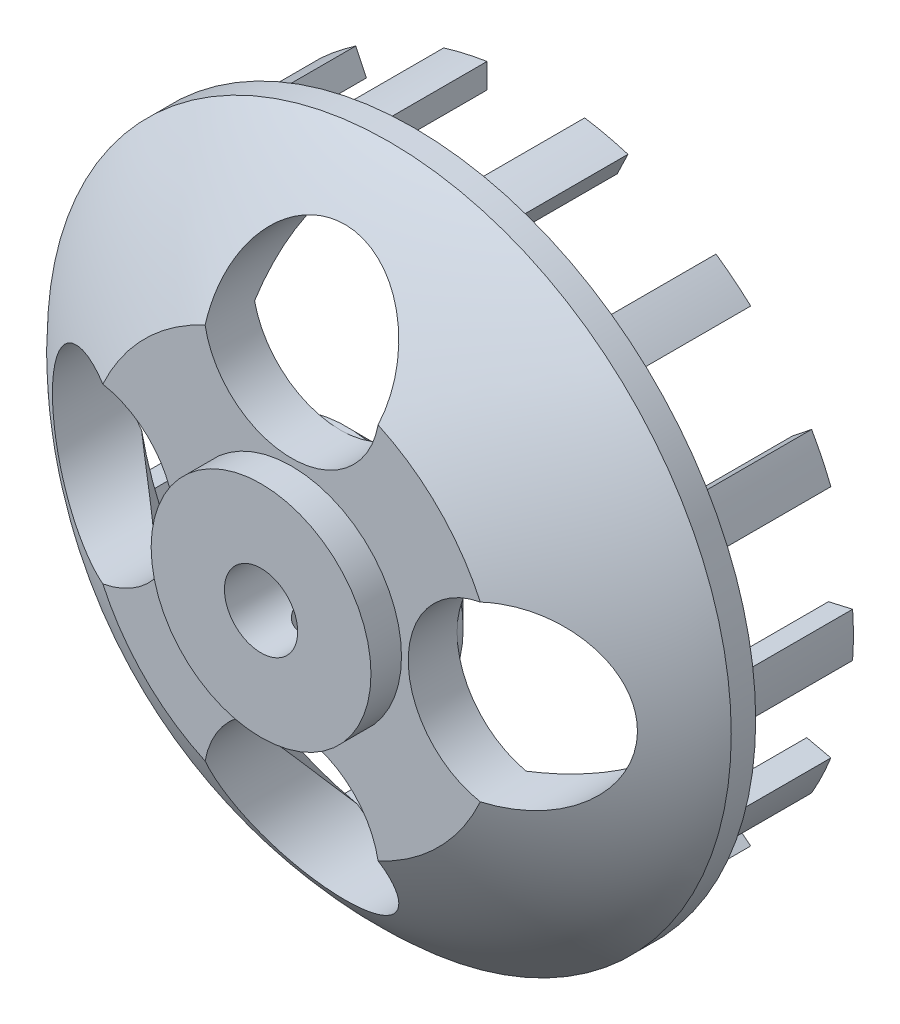
from build123d import *

# Parameters (mm, degrees)
SKETCH1_R           = 14
BOSS_EXTRUDE1_DEPTH = 22
SKETCH2_R           = 12
CUT_EXTRUDE1_DEPTH  = 15
SKETCH3_R           = 17.036826926
SKETCH3_R_2         = 13
CUT_EXTRUDE2_DEPTH  = 15
SKETCH4_R           = 15.163293939
CUT_EXTRUDE3_DEPTH  = 10
SKETCH5_R           = 16.994892588
SKETCH5_R_2         = 4.5
CUT_EXTRUDE4_DEPTH  = 2
SKETCH8_R           = 3.6
CUT_EXTRUDE5_DEPTH  = 7
CIRPATTERN1_COUNT   = 4
SKETCH11_R          = 5.620004384
CUT_EXTRUDE6_DEPTH  = 0.75
SKETCH12_R          = 1.5
CUT_EXTRUDE7_DEPTH  = 18
SKETCH13_R          = 8.375
SKETCH13_R_2        = 4.775
CUT_EXTRUDE8_DEPTH  = 3
FILLET1_SIZE        = 2.75
FILLET2_SIZE        = 3
SKETCH14_W          = 4
SKETCH14_H          = 4.217169846
CUT_EXTRUDE10_DEPTH = 5
CIRPATTERN3_COUNT   = 14
CIRPATTERN3_ANGLE   = 334.282
SKETCH16_R          = 0.75
CUT_EXTRUDE11_DEPTH = 6


with BuildPart() as part:
    # Sketch1 → Boss-Extrude1 (new body)
    with BuildSketch(Plane.XY):
        Circle(SKETCH1_R)
    extrude(amount=BOSS_EXTRUDE1_DEPTH)

    # Sketch2 → Cut-Extrude1 (cut)
    with BuildSketch(Plane(origin=(0, 0, 0), x_dir=(-1, 0, 0), z_dir=(0, 0, -1))):
        Circle(SKETCH2_R)
    extrude(amount=-CUT_EXTRUDE1_DEPTH, mode=Mode.SUBTRACT)

    # Sketch3 → Cut-Extrude2 (cut)
    with BuildSketch(Plane(origin=(0, 0, 0), x_dir=(-1, 0, 0), z_dir=(0, 0, -1))):
        Circle(SKETCH3_R)
        Circle(SKETCH3_R_2, mode=Mode.SUBTRACT)
    extrude(amount=-CUT_EXTRUDE2_DEPTH, mode=Mode.SUBTRACT)

    # Sketch4 → Cut-Extrude3 (cut)
    with BuildSketch(Plane(origin=(0, 0, 0), x_dir=(-1, 0, 0), z_dir=(0, 0, -1))):
        Circle(SKETCH4_R)
    extrude(amount=-CUT_EXTRUDE3_DEPTH, mode=Mode.SUBTRACT)

    # Sketch5 → Cut-Extrude4 (cut)
    with BuildSketch(Plane.XY.offset(22)):
        Circle(SKETCH5_R)
        Circle(SKETCH5_R_2, mode=Mode.SUBTRACT)
    extrude(amount=-CUT_EXTRUDE4_DEPTH, mode=Mode.SUBTRACT)

    # Sketch8 → Cut-Extrude5 (cut)
    with BuildSketch(Plane.XY.offset(20)):
        with Locations((0, 8.375)):
            Circle(SKETCH8_R)
    cut_extrude5 = extrude(amount=-CUT_EXTRUDE5_DEPTH, mode=Mode.SUBTRACT)

    # CirPattern1: Cut-Extrude5 ×4 about axis
    cirpattern1_axis = Axis((0, 0, 0), (0, 0, 1))
    for i in range(1, CIRPATTERN1_COUNT):
        add(cut_extrude5.rotate(cirpattern1_axis, i * 360 / CIRPATTERN1_COUNT), mode=Mode.SUBTRACT)

    # Sketch7 → Cut-Revolve2 (revolve, cut)
    with BuildSketch(Plane(origin=(0, 0, 0), x_dir=(1, 0, 0), z_dir=(0, 1, 0))):
        with BuildLine():
            Line((-14, -16), (-16.211067118, -22.850526422))
            Line((-16.211067118, -22.850526422), (-8.5, -20))
            add(Edge.make_bspline(
                [(-8.5, -20), (-12.342847144, -17.893785877), (-14, -16)],
                knots=[0, 0, 0, 1, 1, 1], degree=2))
        make_face()
    revolve(axis=Axis((0, 0, 9.142490177), (0, 0, 1)), mode=Mode.SUBTRACT)

    # Sketch11 → Cut-Extrude6 (cut)
    with BuildSketch(Plane.XY.offset(22)):
        Circle(SKETCH11_R)
    extrude(amount=-CUT_EXTRUDE6_DEPTH, mode=Mode.SUBTRACT)

    # Sketch12 → Cut-Extrude7 (cut)
    with BuildSketch(Plane.XY.offset(21.25)):
        Circle(SKETCH12_R)
    extrude(amount=-CUT_EXTRUDE7_DEPTH, mode=Mode.SUBTRACT)

    # Sketch13 → Cut-Extrude8 (cut)
    with BuildSketch(Plane(origin=(0, 0, 15), x_dir=(-1, 0, 0), z_dir=(0, 0, -1))):
        Circle(SKETCH13_R)
        Circle(SKETCH13_R_2, mode=Mode.SUBTRACT)
    extrude(amount=-CUT_EXTRUDE8_DEPTH, mode=Mode.SUBTRACT)

    # Fillet1
    fillet1_edges = [part.edges().sort_by_distance(p)[0] for p in [
        (4.775, 0, 15),
    ]]
    chamfer(fillet1_edges, length=FILLET1_SIZE)

    # Fillet2
    # the kernel refuses this chamfer: 3 mm, written as the material it takes off along each edge
    with BuildSketch(Plane(origin=(0, 0, 15), x_dir=(-0.4688986407455129, 0.8832519825661364, 0), z_dir=(-0.8832519825661364, -0.4688986407455129, 0))) as fillet2_piece_1_section:
        Polygon((8.375, -FILLET2_SIZE), (8.375 + FILLET2_SIZE, 0), (8.375, 0), align=None)
    fillet2_piece_1 = revolve(axis=Axis((0, 0, 15), (0, 0, -1)), revolution_arc=145.925657294, mode=Mode.PRIVATE)
    fillet2_piece_1 = split(fillet2_piece_1, bisect_by=Plane(origin=(6.988160105, 6.988160105, 18), z_dir=(0, 0, -1)), keep=Keep.TOP, mode=Mode.PRIVATE)
    add(fillet2_piece_1, mode=Mode.SUBTRACT)
    with BuildSketch(Plane(origin=(0, 0, 15), x_dir=(0.4688986407455169, -0.8832519825661342, 0), z_dir=(0.8832519825661342, 0.4688986407455169, 0))) as fillet2_piece_2_section:
        Polygon((8.375, -FILLET2_SIZE), (8.375 + FILLET2_SIZE, 0), (8.375, 0), align=None)
    fillet2_piece_2 = revolve(axis=Axis((0, 0, 15), (0, 0, -1)), revolution_arc=145.925657294, mode=Mode.PRIVATE)
    fillet2_piece_2 = split(fillet2_piece_2, bisect_by=Plane(origin=(-6.988160104, -6.988160104, 18), z_dir=(0, 0, -1)), keep=Keep.TOP, mode=Mode.PRIVATE)
    add(fillet2_piece_2, mode=Mode.SUBTRACT)
    with BuildSketch(Plane(origin=(0, 0, 15), x_dir=(0.8832519825661352, 0.4688986407455149, 0), z_dir=(-0.4688986407455149, 0.8832519825661352, 0))) as fillet2_piece_3_section:
        Polygon((8.375, -FILLET2_SIZE), (8.375 + FILLET2_SIZE, 0), (8.375, 0), align=None)
    fillet2_piece_3 = revolve(axis=Axis((0, 0, 15), (0, 0, -1)), revolution_arc=145.925657294, mode=Mode.PRIVATE)
    fillet2_piece_3 = split(fillet2_piece_3, bisect_by=Plane(origin=(6.988160105, -6.988160105, 18), z_dir=(0, 0, -1)), keep=Keep.TOP, mode=Mode.PRIVATE)
    add(fillet2_piece_3, mode=Mode.SUBTRACT)
    with BuildSketch(Plane(origin=(0, 0, 15), x_dir=(-0.8832519825661325, -0.46889864074552023, 0), z_dir=(0.46889864074552023, -0.8832519825661325, 0))) as fillet2_piece_4_section:
        Polygon((8.375, -FILLET2_SIZE), (8.375 + FILLET2_SIZE, 0), (8.375, 0), align=None)
    fillet2_piece_4 = revolve(axis=Axis((0, 0, 15), (0, 0, -1)), revolution_arc=145.925657294, mode=Mode.PRIVATE)
    fillet2_piece_4 = split(fillet2_piece_4, bisect_by=Plane(origin=(-6.988160105, 6.988160105, 18), z_dir=(0, 0, -1)), keep=Keep.TOP, mode=Mode.PRIVATE)
    add(fillet2_piece_4, mode=Mode.SUBTRACT)

    # Sketch14 → Cut-Extrude10 (cut)
    with BuildSketch(Plane(origin=(0, 0, 10), x_dir=(-1, 0, 0), z_dir=(0, 0, -1))):
        with Locations((0, 13.940744489)):
            Rectangle(SKETCH14_W, SKETCH14_H)
    cut_extrude10 = extrude(amount=-CUT_EXTRUDE10_DEPTH, mode=Mode.SUBTRACT)

    # CirPattern3: Cut-Extrude10 ×14 about axis
    cirpattern3_axis = Axis((0, 0, 0), (0, 0, 1))
    for i in range(1, CIRPATTERN3_COUNT):
        add(cut_extrude10.rotate(cirpattern3_axis, i * CIRPATTERN3_ANGLE / (CIRPATTERN3_COUNT - 1)), mode=Mode.SUBTRACT)

    # Sketch16 → Cut-Extrude11 (cut)
    with BuildSketch(Plane(origin=(0, 0, 0), x_dir=(1, 0, 0), z_dir=(0, 1, 0))):
        with Locations(Location((0, -18.946648634, 0), (0, 0, 270))):
            Circle(SKETCH16_R)
    extrude(amount=-CUT_EXTRUDE11_DEPTH, mode=Mode.SUBTRACT)


solid = part.part
